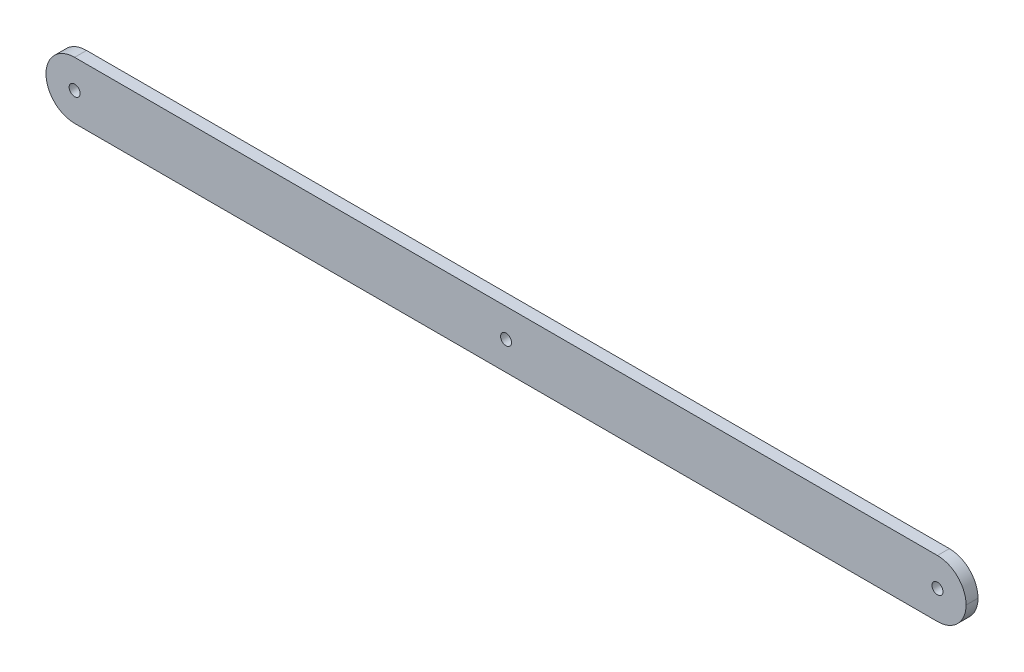
from build123d import *

# Parameters (mm, degrees)
SKETCH1_W           = 245.11
SKETCH1_H           = 15.24
BOSS_EXTRUDE1_DEPTH = 3.175
FILLET2_R           = 7.62
SKETCH3_R           = 1.4605
CUT_EXTRUDE1_DEPTH  = 123.832703504


with BuildPart() as part:
    # Sketch1 → Boss-Extrude1 (new body)
    with BuildSketch(Plane.XY):
        Rectangle(SKETCH1_W, SKETCH1_H)
    extrude(amount=BOSS_EXTRUDE1_DEPTH)

    # Fillet2
    fillet2_edges = [part.edges().sort_by_distance(p)[0] for p in [
        (-122.555, -7.62, 1.5875),
        (-122.555, 7.62, 1.5875),
        (122.555, -7.62, 1.5875),
        (122.555, 7.62, 1.5875),
    ]]
    fillet(fillet2_edges, radius=FILLET2_R - 0.0001)  # a hair under: the kernel refuses the full size

    # Sketch3 → Cut-Extrude1 (cut, through all)
    with BuildSketch(Plane.XY.offset(3.175)):
        with Locations((-114.935, 0)):
            Circle(SKETCH3_R)
        with Locations((114.935, 0)):
            Circle(SKETCH3_R)
        Circle(SKETCH3_R)
    extrude(amount=-CUT_EXTRUDE1_DEPTH, mode=Mode.SUBTRACT)


solid = part.part
